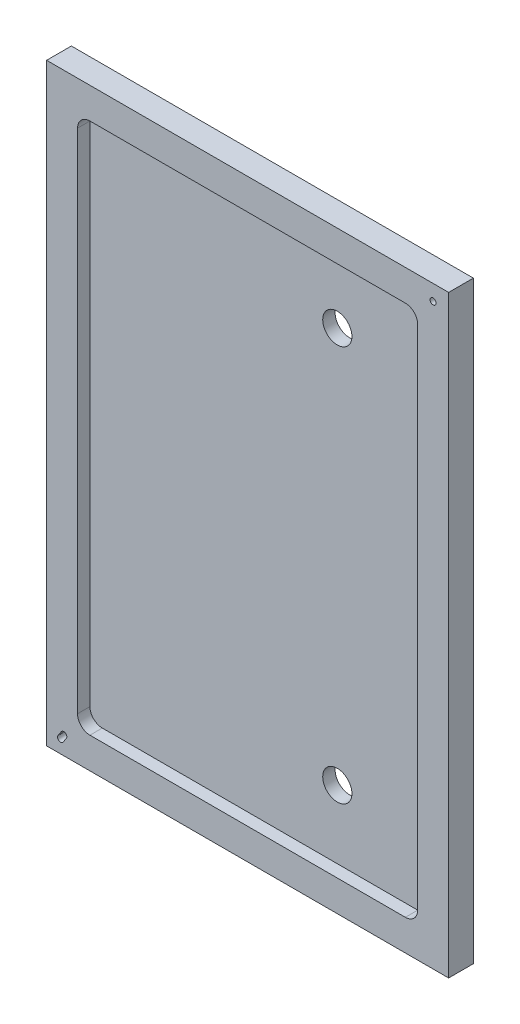
from build123d import *

# Parameters (mm, degrees)
SKETCH1_W                      = 206.375
SKETCH1_H                      = 304.8
BOSS_EXTRUDE1_DEPTH            = 12.7
CUT_EXTRUDE1_DEPTH             = 6.35
SKETCH4_R                      = 7.5
CUT_EXTRUDE3_DEPTH             = 185.484986262
F_3_1_3_1_DIAMETER_HOLE1_D     = 3.1
F_3_1_3_1_DIAMETER_HOLE1_DEPTH = 5
F_3_1_3_1_DIAMETER_HOLE1_TIP   = 0.931333959
CUT_EXTRUDE4_DEPTH             = 5
M4X0_7_TAPPED_HOLE1_D          = 3.3
M4X0_7_TAPPED_HOLE1_DEPTH      = 5.4
M4X0_7_TAPPED_HOLE1_TIP        = 0.991420021


with BuildPart() as part:
    # Sketch1 → Boss-Extrude1 (new body)
    with BuildSketch(Plane.XY):
        Rectangle(SKETCH1_W, SKETCH1_H)
    extrude(amount=BOSS_EXTRUDE1_DEPTH)

    # Sketch2 → Cut-Extrude1 (cut)
    with BuildSketch(Plane.XY.offset(12.7)):
        with BuildLine():
            Line((80.9625, -136.525), (-80.9625, -136.525))
            ThreePointArc((-80.9625, -136.525), (-85.452628061, -134.665128061), (-87.3125, -130.175))
            Line((-87.3125, -130.175), (-87.3125, 130.175))
            ThreePointArc((-87.3125, 130.175), (-85.452628061, 134.665128061), (-80.9625, 136.525))
            Line((-80.9625, 136.525), (80.9625, 136.525))
            ThreePointArc((80.9625, 136.525), (85.452628061, 134.665128061), (87.3125, 130.175))
            Line((87.3125, 130.175), (87.3125, -130.175))
            ThreePointArc((87.3125, -130.175), (85.452628061, -134.665128061), (80.9625, -136.525))
        make_face()
    extrude(amount=-CUT_EXTRUDE1_DEPTH, mode=Mode.SUBTRACT)

    # Sketch4 → Cut-Extrude3 (cut, through all)
    with BuildSketch(Plane(origin=(0, 0, 0), x_dir=(-1, 0, 0), z_dir=(0, 0, -1))):
        with Locations((-39.6875, -101.6)):
            Circle(SKETCH4_R)
        with Locations((-39.6875, 101.6)):
            Circle(SKETCH4_R)
    extrude(amount=-CUT_EXTRUDE3_DEPTH, mode=Mode.SUBTRACT)

    # Ø3.1 (3.1) Diameter Hole1
    with Locations(Plane.XY.offset(12.7)):
        with Locations((95.1875, 144.4)):
            Hole(F_3_1_3_1_DIAMETER_HOLE1_D / 2, depth=F_3_1_3_1_DIAMETER_HOLE1_DEPTH)
            with Locations((0, 0, -(F_3_1_3_1_DIAMETER_HOLE1_DEPTH + F_3_1_3_1_DIAMETER_HOLE1_TIP / 2))):  # 118° drill point
                Cone(0, F_3_1_3_1_DIAMETER_HOLE1_D / 2, F_3_1_3_1_DIAMETER_HOLE1_TIP, mode=Mode.SUBTRACT)

    # Sketch9 → Cut-Extrude4 (cut)
    with BuildSketch(Plane.XY.offset(12.7)):
        with BuildLine():
            Line((-97.307928502, -144.795326406), (-95.652117546, -142.29366894))
            ThreePointArc((-95.652117546, -142.29366894), (-93.504092195, -141.856648243), (-93.067071498, -144.004673594))
            Line((-93.067071498, -144.004673594), (-94.722882454, -146.50633106))
            ThreePointArc((-94.722882454, -146.50633106), (-96.870907805, -146.943351757), (-97.307928502, -144.795326406))
        make_face()
    extrude(amount=-CUT_EXTRUDE4_DEPTH, mode=Mode.SUBTRACT)

    # M4x0.7 Tapped Hole1
    with Locations(Plane(origin=(0, 0, 0), x_dir=(-1, 0, 0), z_dir=(0, 0, -1))):
        with Locations((95.1875, -113.6), (95.1875, 113.6)):
            Hole(M4X0_7_TAPPED_HOLE1_D / 2, depth=M4X0_7_TAPPED_HOLE1_DEPTH)
            with Locations((0, 0, -(M4X0_7_TAPPED_HOLE1_DEPTH + M4X0_7_TAPPED_HOLE1_TIP / 2))):  # 118° drill point
                Cone(0, M4X0_7_TAPPED_HOLE1_D / 2, M4X0_7_TAPPED_HOLE1_TIP, mode=Mode.SUBTRACT)


solid = part.part
